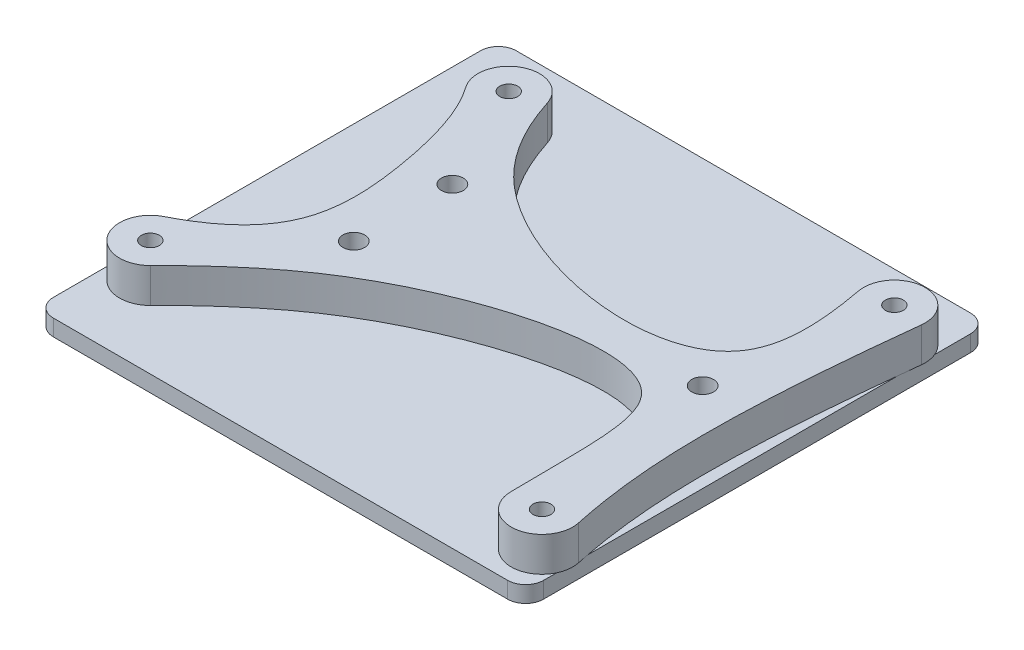
from build123d import *

# Parameters (mm, degrees)
SKETCH1_W           = 90
SKETCH1_H           = 85
BOSS_EXTRUDE1_DEPTH = 3
SKETCH4_R           = 1.65
SKETCH4_R_2         = 2
BOSS_EXTRUDE2_DEPTH = 6.35
SKETCH4_3_R         = 1.65
CUT_EXTRUDE1_DEPTH  = 83.993665433
FILLET1_R           = 3.3


with BuildPart() as part:
    # Sketch1 → Boss-Extrude1 (new body)
    with BuildSketch(Plane(origin=(0, 0, 0), x_dir=(1, 0, 0), z_dir=(0, 1, 0))):
        with Locations((15.941430843, -12.87535482)):
            Rectangle(SKETCH1_W, SKETCH1_H)
    extrude(amount=BOSS_EXTRUDE1_DEPTH)

    # Sketch4<3> → Cut-Extrude1 (cut, through all)
    with BuildSketch(Plane(origin=(0, 3, 0), x_dir=(1, 0, 0), z_dir=(0, 1, 0))):
        with Locations((-13.658569157, 16.12464518)):
            Circle(SKETCH4_3_R)
        with Locations((55.741430843, 17.52464518)):
            Circle(SKETCH4_3_R)
        with Locations((-22.858569157, -40.47535482)):
            Circle(SKETCH4_3_R)
        with Locations((55.841430843, -47.27535482)):
            Circle(SKETCH4_3_R)
    extrude(amount=-CUT_EXTRUDE1_DEPTH, mode=Mode.SUBTRACT)

    # Fillet1
    fillet1_edges = [part.edges().sort_by_distance(p)[0] for p in [
        (-29.058569157, 1.5, 55.37535482),
        (60.941430843, 1.5, 55.37535482),
        (60.941430843, 1.5, -29.62464518),
        (-29.058569157, 1.5, -29.62464518),
    ]]
    fillet(fillet1_edges, radius=FILLET1_R)


with BuildPart() as body_2:
    # Sketch4 → Boss-Extrude2 (new body)
    with BuildSketch(Plane(origin=(0, 3, 0), x_dir=(1, 0, 0), z_dir=(0, 1, 0))):
        with BuildLine():
            ThreePointArc((-8.283067345, 17.864323387), (-16.199767479, 21.170912225), (-18.256911207, 12.84169675))
            add(Edge.make_bspline(
                [(-18.256911207, 12.84169675), (-14.92913649, 8.180567665), (-11.474229497, -4.299496978), (-9.93847644, -23.715578027), (-18.304090766, -31.835085279), (-25.411515924, -35.435021219)],
                knots=[0, 0, 0, 0, 0.348075626, 0.653605665, 1, 1, 1, 1], degree=3))
            ThreePointArc((-25.411515924, -35.435021219), (-27.429243311, -43.796715653), (-18.853178535, -44.460244525))
            add(Edge.make_bspline(
                [(-18.853178535, -44.460244525), (-14.475177411, -40.059720058), (4.008938201, -22.223634722), (51.742301245, -8.842814223), (49.964952893, -31.64353292), (50.19202066, -47.356991777)],
                knots=[0, 0, 0, 0, 0.247102159, 0.71381752, 1.000000001, 1.000000001, 1.000000001, 1.000000001], degree=3))
            ThreePointArc((50.19202066, -47.356991777), (56.478789612, -52.889290498), (61.365360002, -46.088465341))
            add(Edge.make_bspline(
                [(61.365360002, -46.088465341), (58.937486206, -34.788843016), (58.574256962, -23.966071998), (58.936942589, -13.143294965), (59.267804417, -3.270160996), (60.202779447, 6.602977947), (61.356278652, 16.895372523)],
                knots=[0.967910845, 0.967910845, 0.967910845, 0.967910845, 1.490853614, 1.490853616, 1.490853616, 1.967910881, 1.967910881, 1.967910881, 1.967910881], degree=3))
            ThreePointArc((61.356278652, 16.895372523), (55.526404465, 23.170551986), (50.190710775, 16.470127882))
            add(Edge.make_bspline(
                [(50.190710775, 16.470127882), (52.644819358, 3.552303028), (51.229075419, -2.859768981), (36.588288176, -13.25478094), (3.724548889, -6.934694412), (-6.34166017, 11.865491104), (-8.283067345, 17.864323387)],
                knots=[0.735099529, 0.735099529, 0.735099529, 0.735099529, 0.999999998, 1, 1.523536868, 1.735099533, 1.735099533, 1.735099533, 1.735099533], degree=3))
        make_face()
        with Locations((-13.658569157, 16.12464518)):
            Circle(SKETCH4_R, mode=Mode.SUBTRACT)
        with Locations((-4.058569157, -3.82535482)):
            Circle(SKETCH4_R_2, mode=Mode.SUBTRACT)
        with Locations((50.941430843, -12.87535482)):
            Circle(SKETCH4_R_2, mode=Mode.SUBTRACT)
        with Locations((-4.058569157, -21.92535482)):
            Circle(SKETCH4_R_2, mode=Mode.SUBTRACT)
        with Locations((55.741430843, 17.52464518)):
            Circle(SKETCH4_R, mode=Mode.SUBTRACT)
        with Locations((55.841430843, -47.27535482)):
            Circle(SKETCH4_R, mode=Mode.SUBTRACT)
        with Locations((-22.858569157, -40.47535482)):
            Circle(SKETCH4_R, mode=Mode.SUBTRACT)
    extrude(amount=BOSS_EXTRUDE2_DEPTH)


solid = Compound([part.part, body_2.part])
